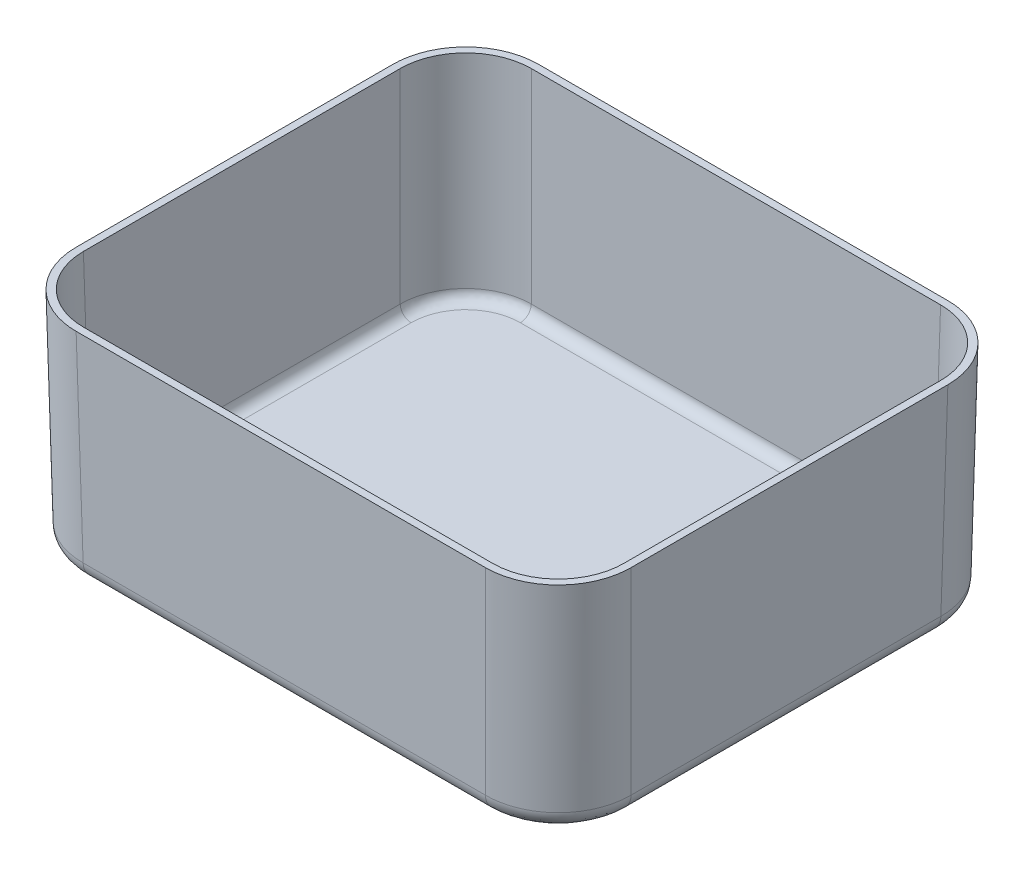
from build123d import *

# Parameters (mm, degrees)
SKETCH1_W           = 152.4
SKETCH1_H           = 127
BOSS_EXTRUDE1_DEPTH = 60
BOSS_EXTRUDE1_DRAFT = -1
FILLET1_R           = 20
FILLET2_R           = 5
SHELL1_T            = -2


with BuildPart() as part:
    # Sketch1 → Boss-Extrude1 (with draft: the straight prism first)
    with BuildSketch(Plane(origin=(0, 0, 0), x_dir=(1, 0, 0), z_dir=(0, 1, 0))):
        Rectangle(SKETCH1_W, SKETCH1_H)
    extrude(amount=-BOSS_EXTRUDE1_DEPTH)
    # Boss-Extrude1: the draft: its side faces are tilted about the plane it starts from
    boss_extrude1_sides = [part.faces().sort_by_distance(p)[0] for p in [
        (-76.2, -30, 0),
        (0, -30, 63.5),
        (76.2, -30, 0),
        (0, -30, -63.5),
    ]]
    draft(boss_extrude1_sides, Plane(origin=(0, 0, 0), x_dir=(1, 0, 0), z_dir=(0, 1, 0)), BOSS_EXTRUDE1_DRAFT)

    # Fillet1
    fillet1_edges = [part.edges().sort_by_distance(p)[0] for p in [
        (-75.676348052, -30, -62.976348052),
        (-75.676348052, -30, 62.976348052),
        (75.676348052, -30, 62.976348052),
        (75.676348052, -30, -62.976348052),
    ]]
    fillet(fillet1_edges, radius=FILLET1_R)

    # Fillet2
    fillet2_edges = [part.edges().sort_by_distance(p)[0] for p in [
        (-69.296093327, -60, 56.596093327),
        (0, -60, 62.452696104),
        (69.296093327, -60, 56.596093327),
        (75.152696104, -60, 0),
        (69.296093327, -60, -56.596093327),
        (0, -60, -62.452696104),
        (-69.296093327, -60, -56.596093327),
        (-75.152696104, -60, 0),
    ]]
    fillet(fillet2_edges, radius=FILLET2_R)

    # Shell1
    shell1_openings = [part.faces().sort_by_distance(p)[0] for p in [
        (0, 0, 0),
    ]]
    offset(amount=SHELL1_T, openings=shell1_openings, kind=Kind.INTERSECTION)


solid = part.part
